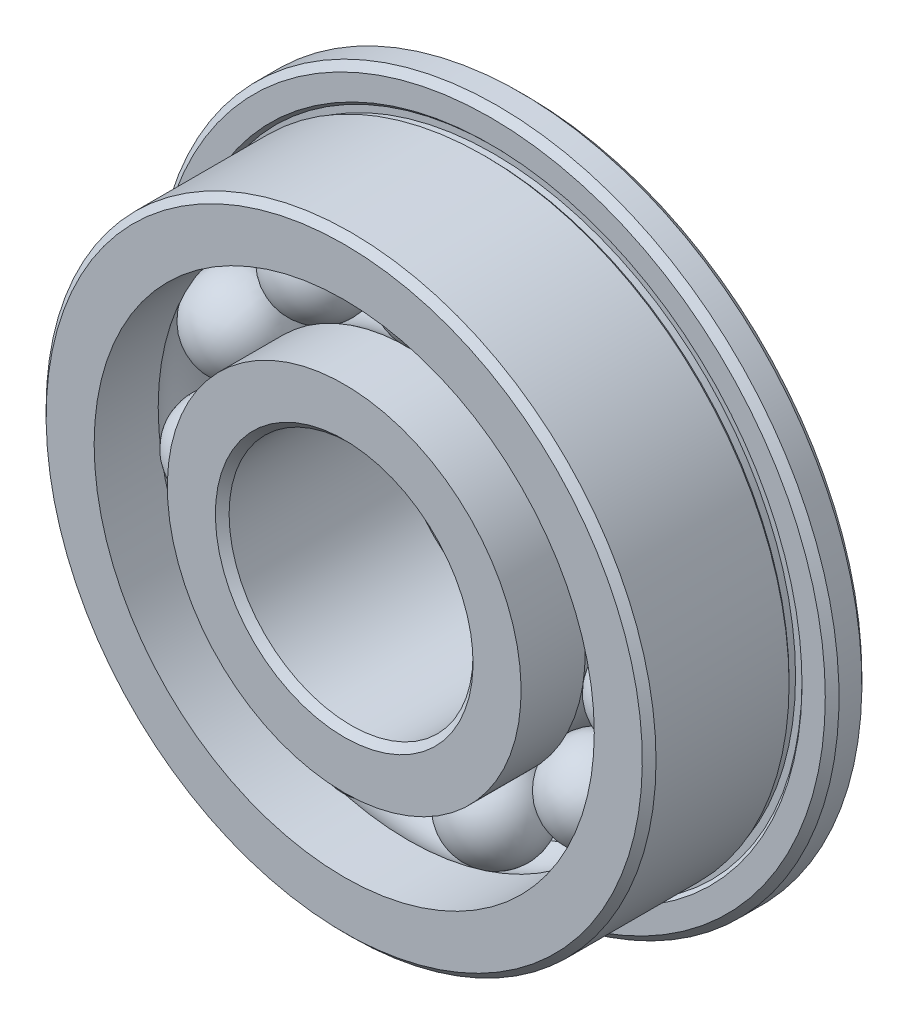
from build123d import *

# Parameters (mm, degrees)
FILLET1_SIZE      = 0.1125
FILLET2_SIZE      = 0.1125
CIRPATTERN3_COUNT = 11


with BuildPart() as part:
    # Sketch2 → Revolve1 (revolve)
    with BuildSketch(Plane(origin=(0, 0, 0), x_dir=(0, 0, -1), z_dir=(1, 0, 0))):
        with BuildLine():
            Line((1.5, 5.6), (0.9, 5.6))
            Line((0.9, 5.6), (0.9, 5.106066017))
            Line((0.9, 5.106066017), (0.953033009, 5.053033009))
            Line((0.953033009, 5.053033009), (0.953033009, 4.946966991))
            Line((0.953033009, 4.946966991), (0.846966991, 4.946966991))
            Line((0.846966991, 4.946966991), (0.793933983, 5))
            Line((0.793933983, 5), (-1.5, 5))
            Line((-1.5, 5), (-1.5, 4.1))
            Line((-1.5, 4.1), (-0.45, 4.1))
            ThreePointArc((-0.45, 4.1), (0, 4.25), (0.45, 4.1))
            Line((0.45, 4.1), (1.5, 4.1))
            Line((1.5, 4.1), (1.5, 5.6))
        make_face()
        with BuildLine():
            Line((1.5, 2), (-1.5, 2))
            Line((-1.5, 2), (-1.5, 2.9))
            Line((-1.5, 2.9), (-0.45, 2.9))
            ThreePointArc((-0.45, 2.9), (0, 2.75), (0.45, 2.9))
            Line((0.45, 2.9), (1.5, 2.9))
            Line((1.5, 2.9), (1.5, 2))
        make_face()
    revolve(axis=Axis((0, 0, 0), (0, 0, -1)))

    # Fillet1
    fillet1_edges = [part.edges().sort_by_distance(p)[0] for p in [
        (0, -5.6, -1.5),
        (0, -5.6, -0.9),
        (0, -5, 1.5),
    ]]
    chamfer(fillet1_edges, length=FILLET1_SIZE)

    # Fillet2
    fillet2_edges = [part.edges().sort_by_distance(p)[0] for p in [
        (0, -2, -1.5),
        (0, -2, 1.5),
    ]]
    chamfer(fillet2_edges, length=FILLET2_SIZE)


with BuildPart() as body_2:
    # Sketch7 → Revolve3 (revolve)
    with BuildSketch(Plane.XY):
        with BuildLine():
            Line((0, 4.25), (0, 2.75))
            ThreePointArc((0, 2.75), (-0.75, 3.5), (0, 4.25))
        make_face()
    revolve(axis=Axis((0, 4.25, 0), (0, -1, 0)))


with BuildPart() as cirpattern3_1:
    # CirPattern3: pattern copy
    add(body_2.part.rotate(Axis((0, 0, 0), (0, 0, -1)), 1 * 360 / CIRPATTERN3_COUNT))


with BuildPart() as cirpattern3_2:
    # CirPattern3: pattern copy
    add(body_2.part.rotate(Axis((0, 0, 0), (0, 0, -1)), 2 * 360 / CIRPATTERN3_COUNT))


with BuildPart() as cirpattern3_3:
    # CirPattern3: pattern copy
    add(body_2.part.rotate(Axis((0, 0, 0), (0, 0, -1)), 3 * 360 / CIRPATTERN3_COUNT))


with BuildPart() as cirpattern3_4:
    # CirPattern3: pattern copy
    add(body_2.part.rotate(Axis((0, 0, 0), (0, 0, -1)), 4 * 360 / CIRPATTERN3_COUNT))


with BuildPart() as cirpattern3_5:
    # CirPattern3: pattern copy
    add(body_2.part.rotate(Axis((0, 0, 0), (0, 0, -1)), 5 * 360 / CIRPATTERN3_COUNT))


with BuildPart() as cirpattern3_6:
    # CirPattern3: pattern copy
    add(body_2.part.rotate(Axis((0, 0, 0), (0, 0, -1)), 6 * 360 / CIRPATTERN3_COUNT))


with BuildPart() as cirpattern3_7:
    # CirPattern3: pattern copy
    add(body_2.part.rotate(Axis((0, 0, 0), (0, 0, -1)), 7 * 360 / CIRPATTERN3_COUNT))


with BuildPart() as cirpattern3_8:
    # CirPattern3: pattern copy
    add(body_2.part.rotate(Axis((0, 0, 0), (0, 0, -1)), 8 * 360 / CIRPATTERN3_COUNT))


with BuildPart() as cirpattern3_9:
    # CirPattern3: pattern copy
    add(body_2.part.rotate(Axis((0, 0, 0), (0, 0, -1)), 9 * 360 / CIRPATTERN3_COUNT))


with BuildPart() as cirpattern3_10:
    # CirPattern3: pattern copy
    add(body_2.part.rotate(Axis((0, 0, 0), (0, 0, -1)), 10 * 360 / CIRPATTERN3_COUNT))


solid = Compound([part.part, body_2.part, cirpattern3_1.part, cirpattern3_2.part, cirpattern3_3.part, cirpattern3_4.part, cirpattern3_5.part, cirpattern3_6.part, cirpattern3_7.part, cirpattern3_8.part, cirpattern3_9.part, cirpattern3_10.part])
